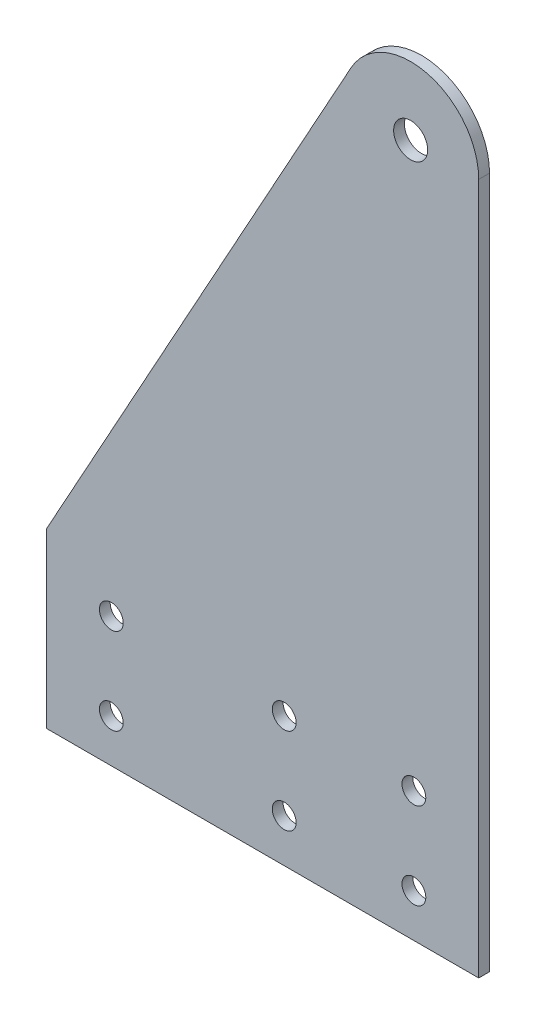
from build123d import *

# Parameters (mm, degrees)
SKETCH1_R           = 5
SKETCH1_R_2         = 3.5
BOSS_EXTRUDE1_DEPTH = 3.175


with BuildPart() as part:
    # Sketch1 → Boss-Extrude1 (new body)
    with BuildSketch(Plane.XY):
        with BuildLine():
            Line((-63.5, -25.4), (63.5, -25.4))
            Line((63.5, -25.4), (63.5, 177.8))
            ThreePointArc((63.5, 177.8), (48.491876086, 197.167012499), (25.991882686, 187.467772655))
            Line((25.991882686, 187.467772655), (-63.5, 25.4))
            Line((-63.5, 25.4), (-63.5, -25.4))
        make_face()
        with Locations((43.5, 177.8)):
            Circle(SKETCH1_R, mode=Mode.SUBTRACT)
        with Locations((-44.45, 12.7)):
            Circle(SKETCH1_R_2, mode=Mode.SUBTRACT)
        with Locations((44.45, 12.7)):
            Circle(SKETCH1_R_2, mode=Mode.SUBTRACT)
        with Locations((44.45, -12.7)):
            Circle(SKETCH1_R_2, mode=Mode.SUBTRACT)
        with Locations((-44.45, -12.7)):
            Circle(SKETCH1_R_2, mode=Mode.SUBTRACT)
        with Locations((6.35, 12.7)):
            Circle(SKETCH1_R_2, mode=Mode.SUBTRACT)
        with Locations((6.35, -12.7)):
            Circle(SKETCH1_R_2, mode=Mode.SUBTRACT)
    extrude(amount=BOSS_EXTRUDE1_DEPTH)


solid = part.part
